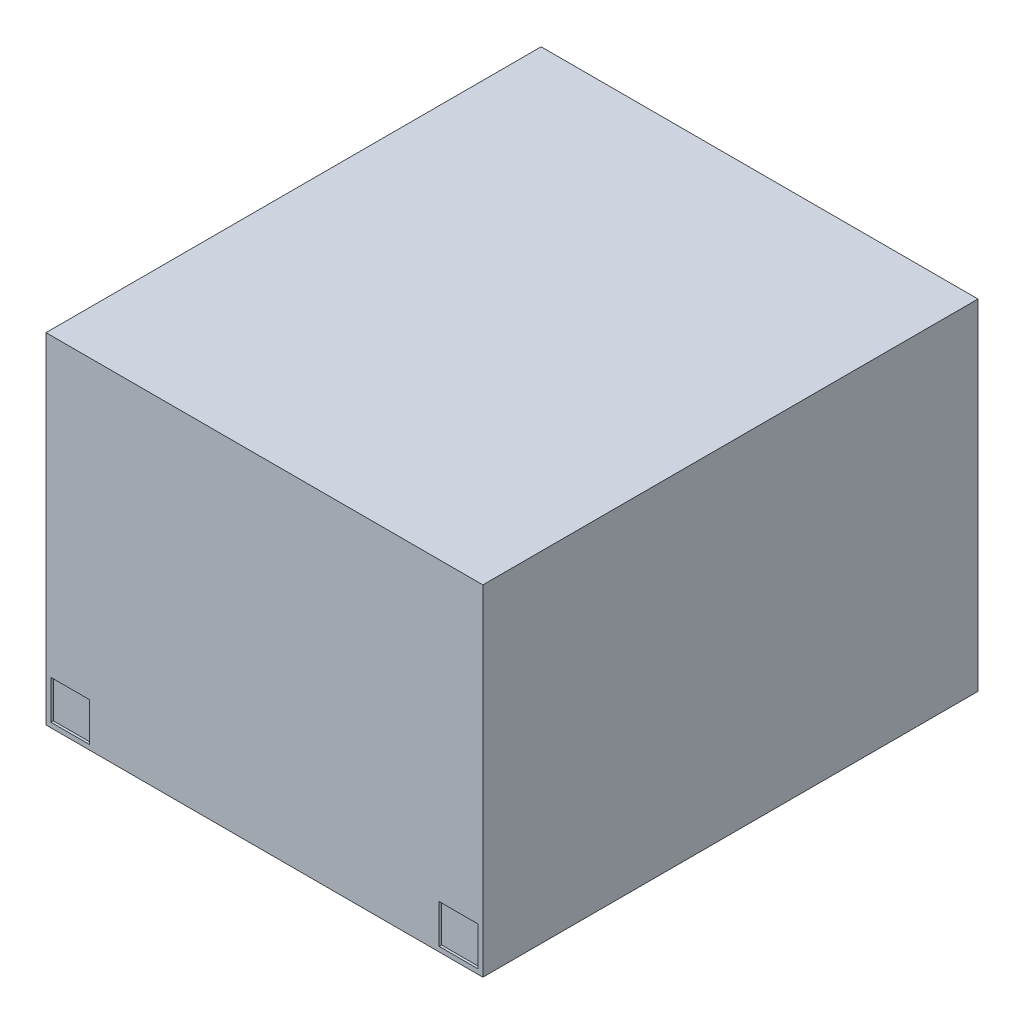
from build123d import *

# Parameters (mm, degrees)
SKETCH_1_W          = 90
SKETCH_1_H          = 70
EXTRUDE_1_DEPTH     = 102
SKETCH_2_W          = 8
SKETCH_2_H          = 8
CUT_EXTRUDE_1_DEPTH = 0.5


with BuildPart() as part:
    # 草圖1 → 填料-伸長1 (new body)
    with BuildSketch(Plane.XY):
        Rectangle(SKETCH_1_W, SKETCH_1_H)
    extrude(amount=EXTRUDE_1_DEPTH)

    # 草圖2 → 除料-伸長1 (cut)
    with BuildSketch(Plane.XY.offset(102)):
        with Locations((-40, -30)):
            Rectangle(SKETCH_2_W, SKETCH_2_H)
    cut_extrude_1 = extrude(amount=-CUT_EXTRUDE_1_DEPTH, mode=Mode.SUBTRACT)

    # 鏡射1: 除料-伸長1 across plane
    add(cut_extrude_1.mirror(Plane(origin=(0, 0, 0), x_dir=(0, 0, 1), z_dir=(1, 0, 0))), mode=Mode.SUBTRACT)


solid = part.part
